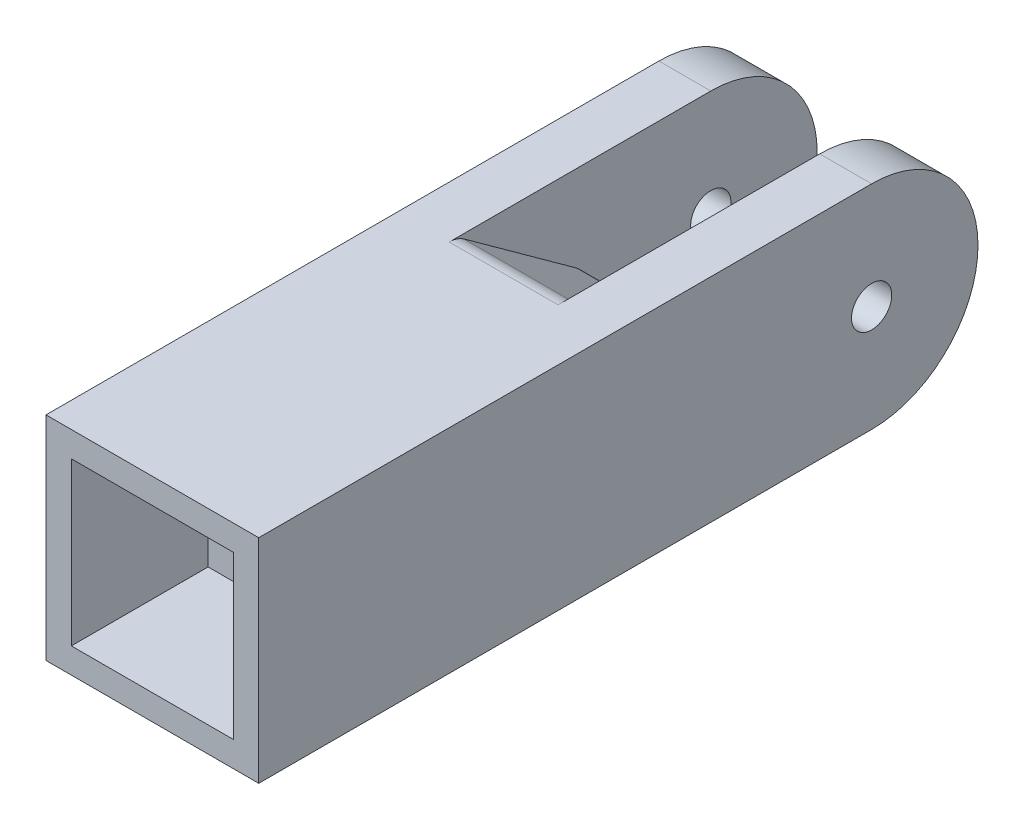
from build123d import *

# Parameters (mm, degrees)
SKETCH2_W           = 42
SKETCH2_H           = 42
BOSS_EXTRUDE1_DEPTH = 100
SKETCH3_W           = 10.25
SKETCH3_H           = 42
BOSS_EXTRUDE2_DEPTH = 21
BOSS_EXTRUDE3_DEPTH = 10.25
BOSS_EXTRUDE4_START = -10.25
BOSS_EXTRUDE4_DEPTH = 10.25
SKETCH6_W           = 32
SKETCH6_H           = 32
CUT_EXTRUDE1_DEPTH  = 27
SKETCH7_R           = 3.975
CUT_EXTRUDE2_DEPTH  = 108.000292056
SKETCH9_R           = 3.975
CUT_EXTRUDE3_DEPTH  = 108.000292056
CUT_EXTRUDE5_DEPTH  = 21.5
FILLET1_R           = 5
FILLET2_R           = 5
FILLET3_R           = 5


with BuildPart() as part:
    # Sketch2 → Boss-Extrude1 (new body)
    with BuildSketch(Plane.XY):
        Rectangle(SKETCH2_W, SKETCH2_H)
    extrude(amount=BOSS_EXTRUDE1_DEPTH)

    # Sketch3 → Boss-Extrude2 (add)
    with BuildSketch(Plane(origin=(0, 0, 0), x_dir=(-1, 0, 0), z_dir=(0, 0, -1))):
        with Locations((15.875, 0)):
            Rectangle(SKETCH3_W, SKETCH3_H)
        with Locations((-15.875, 0)):
            Rectangle(SKETCH3_W, SKETCH3_H)
    extrude(amount=BOSS_EXTRUDE2_DEPTH)

    # Sketch4 → Boss-Extrude3 (add)
    with BuildSketch(Plane.ZY.offset(21)):
        with BuildLine():
            Line((-21, -21), (-21, 21))
            ThreePointArc((-21, 21), (-42, 0), (-21, -21))
        make_face()
    extrude(amount=-BOSS_EXTRUDE3_DEPTH)

    # Sketch5 → Boss-Extrude4 (add)
    with BuildSketch(Plane(origin=(21, 0, 0), x_dir=(0, 0, -1), z_dir=(1, 0, 0)).offset(BOSS_EXTRUDE4_START)):
        with BuildLine():
            Line((21, 21), (21, -21))
            ThreePointArc((21, -21), (42, 0), (21, 21))
        make_face()
    extrude(amount=BOSS_EXTRUDE4_DEPTH)

    # Sketch6 → Cut-Extrude1 (cut)
    with BuildSketch(Plane.XY.offset(100)):
        Rectangle(SKETCH6_W, SKETCH6_H)
    extrude(amount=-CUT_EXTRUDE1_DEPTH, mode=Mode.SUBTRACT)

    # Sketch7 → Cut-Extrude2 (cut, through all)
    with BuildSketch(Plane.ZY.offset(-10.75)):
        with Locations((-21, 0)):
            Circle(SKETCH7_R)
    extrude(amount=-CUT_EXTRUDE2_DEPTH, mode=Mode.SUBTRACT)

    # Sketch9 → Cut-Extrude3 (cut, through all)
    with BuildSketch(Plane(origin=(-10.75, 0, 0), x_dir=(0, 0, -1), z_dir=(1, 0, 0))):
        with Locations((21, 0)):
            Circle(SKETCH9_R)
    extrude(amount=-CUT_EXTRUDE3_DEPTH, mode=Mode.SUBTRACT)

    # Sketch11 → Cut-Extrude5 (cut)
    with BuildSketch(Plane.ZY.offset(-10.75)):
        Polygon((29.025198915, -21), (0, 0), (0, -21), align=None)
        Polygon((0, 21), (0, 0), (29.025198915, 21), align=None)
    extrude(amount=CUT_EXTRUDE5_DEPTH, mode=Mode.SUBTRACT)

    # Fillet1
    fillet1_edges = [part.edges().sort_by_distance(p)[0] for p in [
        (0, 0, 0),
    ]]
    fillet(fillet1_edges, radius=FILLET1_R)

    # Fillet2
    fillet2_edges = [part.edges().sort_by_distance(p)[0] for p in [
        (0, -21, 29.025198915),
    ]]
    fillet(fillet2_edges, radius=FILLET2_R)

    # Fillet3
    fillet3_edges = [part.edges().sort_by_distance(p)[0] for p in [
        (0, 21, 29.025198915),
    ]]
    fillet(fillet3_edges, radius=FILLET3_R)


solid = part.part
